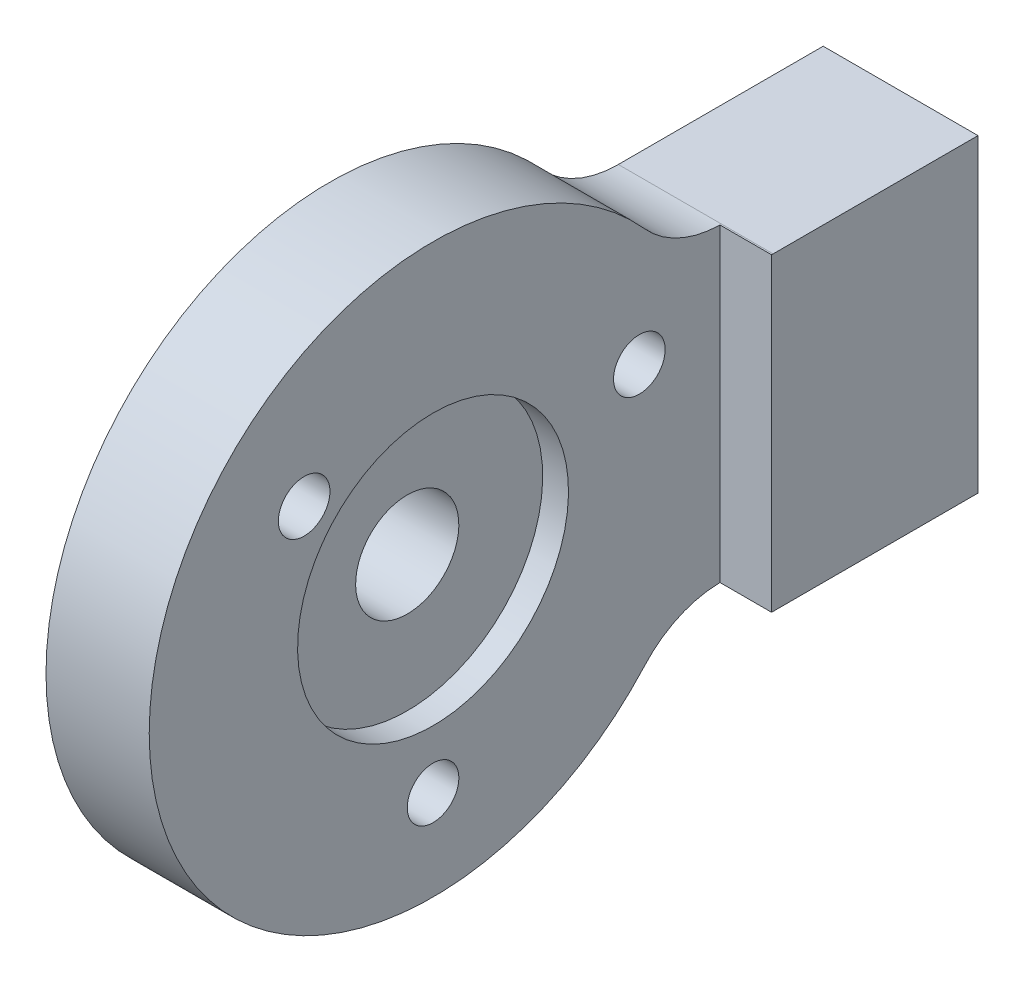
from build123d import *

# Parameters (mm, degrees)
SKETCH1_W             = 6
SKETCH1_H             = 12
EXTRUDE1_DEPTH        = 8
SKETCH3_W             = 4
SKETCH3_H             = 8.6
EXTRUDE2_DEPTH        = 1
SKETCH2_R             = 1.25
EXTRUDE3_DEPTH        = 6
EXTRUDE4_DEPTH        = 4
SKETCH8_R             = 5.25
EXTRUDE7_DEPTH        = 1
SKETCH7_R             = 1
EXTRUDE6_DEPTH        = 4
CIRPATTERN1_COUNT     = 3
SKETCH9_R             = 2
EXTRUDE8_DEPTH        = 3
M3_TAPPED_HOLE1_D     = 2.5
M3_TAPPED_HOLE1_DEPTH = 6
M3_TAPPED_HOLE1_TIP   = 0.751075774
FILLET1_R             = 4


with BuildPart() as part:
    # Sketch1 → Extrude1 (new body)
    with BuildSketch(Plane.XY):
        with Locations((1, 0)):
            Rectangle(SKETCH1_W, SKETCH1_H)
    extrude(amount=EXTRUDE1_DEPTH)

    # Sketch3 → Extrude2 (add)
    with BuildSketch(Plane.XY.offset(8)):
        Rectangle(SKETCH3_W, SKETCH3_H)
    extrude(amount=EXTRUDE2_DEPTH)

    # Sketch2 → Extrude3 (cut)
    with BuildSketch(Plane(origin=(0, 0, 0), x_dir=(-1, 0, 0), z_dir=(0, 0, -1))):
        with Locations((-1, 3)):
            Circle(SKETCH2_R)
        with Locations((-1, -3)):
            Circle(SKETCH2_R)
    extrude(amount=-EXTRUDE3_DEPTH, mode=Mode.SUBTRACT)

    # Sketch4 → Extrude4 (add)
    with BuildSketch(Plane(origin=(2, 0, 0), x_dir=(0, 0, -1), z_dir=(1, 0, 0))):
        with BuildLine():
            Line((-9.900455543, 6), (-8, 6))
            Line((-8, 6), (-8, -6))
            Line((-8, -6), (-9.900455543, -6))
            ThreePointArc((-9.900455543, -6), (-30.12, 0), (-9.900455543, 6))
        make_face()
    extrude(amount=-EXTRUDE4_DEPTH)

    # Sketch8 → Extrude7 (cut)
    with BuildSketch(Plane(origin=(2, 0, 0), x_dir=(0, 0, -1), z_dir=(1, 0, 0))):
        with Locations(Location((-19.12, 0, 0), (0, 0, 90))):
            Circle(SKETCH8_R)
    extrude(amount=-EXTRUDE7_DEPTH, mode=Mode.SUBTRACT)

    # Sketch7 → Extrude6 (cut)
    with BuildSketch(Plane.ZY.offset(2)):
        with Locations(Location((19.12, -7.5, 0), (0, 0, 270))):
            Circle(SKETCH7_R)
    extrude6 = extrude(amount=-EXTRUDE6_DEPTH, mode=Mode.SUBTRACT)

    # CirPattern1: Extrude6 ×3 about axis
    cirpattern1_axis = Axis((0, 0, 18.12), (1, 0, 0))
    for i in range(1, CIRPATTERN1_COUNT):
        add(extrude6.rotate(cirpattern1_axis, i * 360 / CIRPATTERN1_COUNT), mode=Mode.SUBTRACT)

    # Sketch9 → Extrude8 (cut)
    with BuildSketch(Plane(origin=(1, 0, 0), x_dir=(0, 0, -1), z_dir=(1, 0, 0))):
        with Locations(Location((-19.12, 0, 0), (0, 0, 90))):
            Circle(SKETCH9_R)
    extrude(amount=-EXTRUDE8_DEPTH, mode=Mode.SUBTRACT)

    # M3 Tapped Hole1
    with Locations(Plane(origin=(1, 3, 0), x_dir=(-1, 0, 0), z_dir=(0, 0, -1))):
        with Locations((0, 0), (0, -6)):
            Hole(M3_TAPPED_HOLE1_D / 2, depth=M3_TAPPED_HOLE1_DEPTH)
            with Locations((0, 0, -(M3_TAPPED_HOLE1_DEPTH + M3_TAPPED_HOLE1_TIP / 2))):  # 118° drill point
                Cone(0, M3_TAPPED_HOLE1_D / 2, M3_TAPPED_HOLE1_TIP, mode=Mode.SUBTRACT)

    # Fillet1
    # the kernel refuses this fillet: 4 mm, written as the material it adds along each edge
    with BuildSketch(Plane(origin=(6.901988576, -6, 9.900455543), x_dir=(0, 0, -1), z_dir=(-1, 0, 0))) as fillet1_piece_1_section:
        with BuildLine():
            CenterArc((1.96079543, 4), FILLET1_R, 221.810314896, 48.189685104)
            ThreePointArc((-1.02062854, 1.333333333), (-0.484835824, 0.686169688), (0, 0))
            Line((0, 0), (1.96079543, 0))
        make_face()
    fillet1_piece_1 = extrude(amount=8.901988576, mode=Mode.PRIVATE)
    fillet1_piece_1 = split(fillet1_piece_1, bisect_by=Plane(origin=(4, -5.96007597, 7.969858609), z_dir=(-1, 0, 0)), keep=Keep.TOP, mode=Mode.PRIVATE)
    fillet1_piece_1 = split(fillet1_piece_1, bisect_by=Plane(origin=(3, -5.96007597, 8), z_dir=(0, 0, -1)), keep=Keep.TOP, mode=Mode.PRIVATE)
    fillet1_piece_1 = split(fillet1_piece_1, bisect_by=Plane(origin=(2, -5.96007597, 7.969858609), z_dir=(1, 0, 0)), keep=Keep.TOP, mode=Mode.PRIVATE)
    add(fillet1_piece_1)
    with BuildSketch(Plane(origin=(2, -6, 9.900455543), x_dir=(0, 0, -1), z_dir=(-1, 0, 0))) as fillet1_piece_2_section:
        with BuildLine():
            CenterArc((1.96079543, 4), FILLET1_R, 221.810314896, 48.189685104)
            ThreePointArc((-1.02062854, 1.333333333), (-0.484835824, 0.686169688), (0, 0))
            Line((0, 0), (1.96079543, 0))
        make_face()
    fillet1_piece_2 = extrude(amount=4, mode=Mode.PRIVATE)
    fillet1_piece_2 = split(fillet1_piece_2, bisect_by=Plane(origin=(0, -5.96007597, 8), z_dir=(0, 0, -1)), keep=Keep.TOP, mode=Mode.PRIVATE)
    add(fillet1_piece_2)
    with BuildSketch(Plane(origin=(2, -6, 9.900455543), x_dir=(0, 0, -1), z_dir=(-1, 0, 0))) as fillet1_piece_3_section:
        with BuildLine():
            CenterArc((1.96079543, 4), FILLET1_R, 221.810314896, 48.189685104)
            ThreePointArc((-1.02062854, 1.333333333), (-0.484835824, 0.686169688), (0, 0))
            Line((0, 0), (1.96079543, 0))
        make_face()
    fillet1_piece_3 = extrude(amount=4, mode=Mode.PRIVATE)
    fillet1_piece_3 = split(fillet1_piece_3, bisect_by=Plane(origin=(0, -6.284176822, 8), z_dir=(0, 0, 1)), keep=Keep.TOP, mode=Mode.PRIVATE)
    add(fillet1_piece_3)
    with BuildSketch(Plane(origin=(6.901988576, 6, 9.900455543), x_dir=(0, 0, -1), z_dir=(-1, 0, 0))) as fillet1_piece_4_section:
        with BuildLine():
            CenterArc((1.96079543, -4), FILLET1_R, 90, 48.189685104)
            ThreePointArc((-1.02062854, -1.333333333), (-0.484835824, -0.686169688), (0, 0))
            Line((0, 0), (1.96079543, 0))
        make_face()
    fillet1_piece_4 = extrude(amount=8.901988576, mode=Mode.PRIVATE)
    fillet1_piece_4 = split(fillet1_piece_4, bisect_by=Plane(origin=(2, 5.96007597, 7.969858609), z_dir=(1, 0, 0)), keep=Keep.TOP, mode=Mode.PRIVATE)
    fillet1_piece_4 = split(fillet1_piece_4, bisect_by=Plane(origin=(3, 5.96007597, 8), z_dir=(0, 0, -1)), keep=Keep.TOP, mode=Mode.PRIVATE)
    fillet1_piece_4 = split(fillet1_piece_4, bisect_by=Plane(origin=(4, 5.96007597, 7.969858609), z_dir=(-1, 0, 0)), keep=Keep.TOP, mode=Mode.PRIVATE)
    add(fillet1_piece_4)
    with BuildSketch(Plane(origin=(2, 6, 9.900455543), x_dir=(0, 0, -1), z_dir=(-1, 0, 0))) as fillet1_piece_5_section:
        with BuildLine():
            CenterArc((1.96079543, -4), FILLET1_R, 90, 48.189685104)
            ThreePointArc((-1.02062854, -1.333333333), (-0.484835824, -0.686169688), (0, 0))
            Line((0, 0), (1.96079543, 0))
        make_face()
    fillet1_piece_5 = extrude(amount=4, mode=Mode.PRIVATE)
    fillet1_piece_5 = split(fillet1_piece_5, bisect_by=Plane(origin=(0, 5.96007597, 8), z_dir=(0, 0, -1)), keep=Keep.TOP, mode=Mode.PRIVATE)
    add(fillet1_piece_5)
    with BuildSketch(Plane(origin=(2, 6, 9.900455543), x_dir=(0, 0, -1), z_dir=(-1, 0, 0))) as fillet1_piece_6_section:
        with BuildLine():
            CenterArc((1.96079543, -4), FILLET1_R, 90, 48.189685104)
            ThreePointArc((-1.02062854, -1.333333333), (-0.484835824, -0.686169688), (0, 0))
            Line((0, 0), (1.96079543, 0))
        make_face()
    fillet1_piece_6 = extrude(amount=4, mode=Mode.PRIVATE)
    fillet1_piece_6 = split(fillet1_piece_6, bisect_by=Plane(origin=(0, 6.284176822, 8), z_dir=(0, 0, 1)), keep=Keep.TOP, mode=Mode.PRIVATE)
    add(fillet1_piece_6)


solid = part.part
